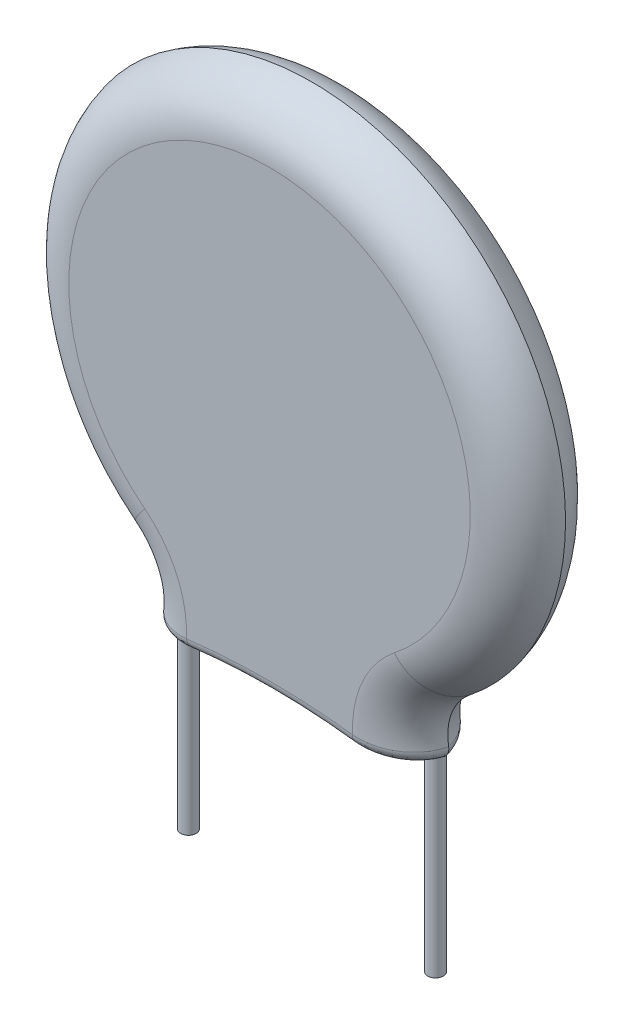
from build123d import *

# Parameters (mm, degrees)
BOSS_EXTRUDE1_DEPTH = 1.375
FILLET1_R           = 1.75
FILLET7_R           = 0.35
WRAP1_START         = -0.01
WRAP1_DEPTH         = 0.01


# Read off the part's stored shape, not the designer's step: Wrap1
with BuildPart() as part:
    # Sketch1 → Boss-Extrude1 (new, symmetric)
    with BuildSketch(Plane.XY):
        with BuildLine():
            ThreePointArc((4.65, -8.75), (4.475030194, -7.520172414), (5.127467489, -6.463093466))
            ThreePointArc((5.127467489, -6.463093466), (0, 8.25), (-5.127467489, -6.463093466))
            ThreePointArc((-5.127467489, -6.463093466), (-4.475030194, -7.520172414), (-4.65, -8.75))
            ThreePointArc((-4.65, -8.75), (0, -8.25), (4.65, -8.75))
        make_face()
    extrude(amount=BOSS_EXTRUDE1_DEPTH, both=True)

    # Fillet1
    # the kernel refuses this fillet: 1.75 mm, written as the material it takes off along each edge
    with BuildSketch(Plane(origin=(-6.262102122, -7.893282872, -1.375), x_dir=(0.6215112107703308, 0.7834052686105688, 0), z_dir=(-0.7834052686105688, 0.6215112107703308, 0))) as fillet1_piece_1:
        with BuildLine():
            CenterArc((1.825606061 + FILLET1_R, -FILLET1_R), FILLET1_R, 90, 90)
            Line((1.825606061 + FILLET1_R, 0), (1.825606061, 0))
            Line((1.825606061, 0), (1.825606061, -FILLET1_R))
        make_face()
    revolve(axis=Axis((-6.262102122, -7.893282872, -1.375), (0, 0, -1)), revolution_arc=216.911277343, mode=Mode.SUBTRACT)
    with BuildSketch(Plane(origin=(0, 0, -1.375), x_dir=(0.62151121077033, -0.7834052686105696, 0), z_dir=(-0.7834052686105696, -0.62151121077033, 0))) as fillet1_piece_2:
        with BuildLine():
            CenterArc((8.25 - FILLET1_R, FILLET1_R), FILLET1_R, 270, 90)
            Line((8.25 - FILLET1_R, 0), (8.25, 0))
            Line((8.25, 0), (8.25, FILLET1_R))
        make_face()
    revolve(axis=Axis((0, 0, -1.375), (0, 0, 1)), revolution_arc=283.146849467, mode=Mode.SUBTRACT)
    with BuildSketch(Plane(origin=(-6.262102122, -7.893282872, 1.375), x_dir=(0.6215112107703308, 0.7834052686105688, 0), z_dir=(-0.7834052686105688, 0.6215112107703308, 0))) as fillet1_piece_3:
        with BuildLine():
            CenterArc((1.825606061 + FILLET1_R, FILLET1_R), FILLET1_R, 180, 90)
            Line((1.825606061 + FILLET1_R, 0), (1.825606061, 0))
            Line((1.825606061, 0), (1.825606061, FILLET1_R))
        make_face()
    revolve(axis=Axis((-6.262102122, -7.893282872, 1.375), (0, 0, -1)), revolution_arc=216.911277343, mode=Mode.SUBTRACT)
    with BuildSketch(Plane(origin=(0, 0, 1.375), x_dir=(0.62151121077033, -0.7834052686105696, 0), z_dir=(-0.7834052686105696, -0.62151121077033, 0))) as fillet1_piece_4:
        with BuildLine():
            CenterArc((8.25 - FILLET1_R, -FILLET1_R), FILLET1_R, 0, 90)
            Line((8.25 - FILLET1_R, 0), (8.25, 0))
            Line((8.25, 0), (8.25, -FILLET1_R))
        make_face()
    revolve(axis=Axis((0, 0, 1.375), (0, 0, 1)), revolution_arc=283.146849467, mode=Mode.SUBTRACT)
    with BuildSketch(Plane(origin=(6.262102122, -7.893282872, -1.375), x_dir=(0.967435187537715, -0.25311886123690236, 0), z_dir=(0.25311886123690236, 0.967435187537715, 0))) as fillet1_piece_5:
        with BuildLine():
            CenterArc((1.825606061 + FILLET1_R, -FILLET1_R), FILLET1_R, 90, 90)
            Line((1.825606061 + FILLET1_R, 0), (1.825606061, 0))
            Line((1.825606061, 0), (1.825606061, -FILLET1_R))
        make_face()
    revolve(axis=Axis((6.262102122, -7.893282872, -1.375), (0, 0, -1)), revolution_arc=216.911277343, mode=Mode.SUBTRACT)
    with BuildSketch(Plane(origin=(6.262102122, -7.893282872, 1.375), x_dir=(0.967435187537715, -0.25311886123690236, 0), z_dir=(0.25311886123690236, 0.967435187537715, 0))) as fillet1_piece_6:
        with BuildLine():
            CenterArc((1.825606061 + FILLET1_R, FILLET1_R), FILLET1_R, 180, 90)
            Line((1.825606061 + FILLET1_R, 0), (1.825606061, 0))
            Line((1.825606061, 0), (1.825606061, FILLET1_R))
        make_face()
    revolve(axis=Axis((6.262102122, -7.893282872, 1.375), (0, 0, -1)), revolution_arc=216.911277343, mode=Mode.SUBTRACT)

    # Fillet7
    fillet7_edges = [part.edges().sort_by_distance(p)[0] for p in [
        (0, -8.25, -1.375),
        (0, -8.25, 1.375),
        (3.883166688, -8.597461727, 0.990381708),
        (3.883166674, -8.597461724, -0.99038172),
        (-3.883166688, -8.597461727, 0.990381708),
        (-3.883166674, -8.597461724, -0.99038172),
    ]]
    fillet(fillet7_edges, radius=FILLET7_R)

    # Wrap1 outline → Wrap1 (cut)
    # profile 1 of 7: a face of its own
    with BuildSketch(Plane(origin=(0, 0, -1.375), x_dir=(-1, 0, 0), z_dir=(0, 0, -1)).offset(WRAP1_START)):
        with BuildLine():
            Line((-3.1328125, 1.921875), (-3.30171131, 1.841145833))
            add(Edge.make_bspline(
                [(-3.30171131, 1.841145833), (-3.308983221, 1.836588799), (-3.325484554, 1.826248034), (-3.335289673, 1.809319532), (-3.34077381, 1.79985119)],
                knots=[0, 0, 0, 0, 0.440686357, 1, 1, 1, 1], degree=3))
            add(Edge.make_bspline(
                [(-3.34077381, 1.79985119), (-3.341785543, 1.795872347), (-3.344084095, 1.786832834), (-3.344823915, 1.777529689), (-3.345238095, 1.772321429)],
                knots=[0, 0, 0, 0, 0.440161289, 1, 1, 1, 1], degree=3))
            add(Edge.make_bspline(
                [(-3.345238095, 1.772321429), (-3.341645939, 1.75263571), (-3.33352536, 1.70813335), (-3.288739574, 1.696558728), (-3.263764881, 1.690104167)],
                knots=[0, 0, 0, 0, 0.442352233, 1, 1, 1, 1], degree=3))
            add(Edge.make_bspline(
                [(-3.263764881, 1.690104167), (-3.25875924, 1.690529932), (-3.247385305, 1.691497366), (-3.236182944, 1.693704626), (-3.229910714, 1.694940476)],
                knots=[0, 0, 0, 0, 0.440097523, 1, 1, 1, 1], degree=3))
            Line((-3.229910714, 1.694940476), (-3.017113095, 1.795758929))
            Line((-3.017113095, 1.795758929), (-2.892857143, 1.964657738))
            Line((-2.892857143, 1.964657738), (-2.892857143, 0.260044643))
            Line((-2.892857143, 0.260044643), (-2.885044643, 0.242931548))
            add(Edge.make_bspline(
                [(-2.885044643, 0.242931548), (-2.874777722, 0.230849901), (-2.851230468, 0.203140559), (-2.814335212, 0.202654873), (-2.793526786, 0.202380952)],
                knots=[0, 0, 0, 0, 0.4360135, 1, 1, 1, 1], degree=3))
            add(Edge.make_bspline(
                [(-2.793526786, 0.202380952), (-2.775613632, 0.204618051), (-2.735633937, 0.209610949), (-2.714446983, 0.244505211), (-2.702752976, 0.263764881)],
                knots=[0, 0, 0, 0, 0.448056269, 1, 1, 1, 1], degree=3))
            Line((-2.702752976, 0.263764881), (-2.702380952, 2.132440476))
            Line((-2.702380952, 2.132440476), (-2.712797619, 2.159598214))
            add(Edge.make_bspline(
                [(-2.712797619, 2.159598214), (-2.725109639, 2.170236987), (-2.753005603, 2.194341792), (-2.789744084, 2.199499579), (-2.810267857, 2.202380952)],
                knots=[0, 0, 0, 0, 0.441354866, 1, 1, 1, 1], degree=3))
            add(Edge.make_bspline(
                [(-2.810267857, 2.202380952), (-2.818421216, 2.202046007), (-2.836875667, 2.201287885), (-2.85203133, 2.1905292), (-2.860491071, 2.18452381)],
                knots=[0, 0, 0, 0, 0.441809915, 1, 1, 1, 1], degree=3))
            Line((-2.860491071, 2.18452381), (-3.1328125, 1.921875))
        make_face()
    # profile 2 of 7: a face of its own
    with BuildSketch(Plane(origin=(0, 0, -1.375), x_dir=(-1, 0, 0), z_dir=(0, 0, -1)).offset(WRAP1_START)):
        with BuildLine():
            Line((0.928571429, -0.395089286), (1.640997024, -2.248139881))
            add(Edge.make_bspline(
                [(1.640997024, -2.248139881), (1.647308346, -2.260858798), (1.66156507, -2.289589717), (1.693746528, -2.294745617), (1.711681548, -2.297619048)],
                knots=[0, 0, 0, 0, 0.44269091, 1, 1, 1, 1], degree=3))
            add(Edge.make_bspline(
                [(1.711681548, -2.297619048), (1.72906646, -2.296816711), (1.768297032, -2.295006168), (1.795972668, -2.26657566), (1.811383929, -2.250744048)],
                knots=[0, 0, 0, 0, 0.443147037, 1, 1, 1, 1], degree=3))
            Line((1.811383929, -2.250744048), (2.523809524, -0.389136905))
            add(Edge.make_bspline(
                [(2.523809524, -0.389136905), (2.52360421, -0.382404249), (2.523138145, -0.367121051), (2.519036072, -0.352373106), (2.516741071, -0.344122024)],
                knots=[0, 0, 0, 0, 0.44052667, 1, 1, 1, 1], degree=3))
            add(Edge.make_bspline(
                [(2.516741071, -0.344122024), (2.505579268, -0.332673805), (2.4801106, -0.306551605), (2.443774609, -0.300832), (2.423363095, -0.297619048)],
                knots=[0, 0, 0, 0, 0.438256296, 1, 1, 1, 1], degree=3))
            add(Edge.make_bspline(
                [(2.423363095, -0.297619048), (2.411382539, -0.300012814), (2.384263898, -0.305431236), (2.364709974, -0.32524766), (2.353794643, -0.336309524)],
                knots=[0, 0, 0, 0, 0.441783061, 1, 1, 1, 1], degree=3))
            Line((2.353794643, -0.336309524), (1.725074405, -2.045386905))
            Line((1.725074405, -2.045386905), (1.102678571, -0.345610119))
            add(Edge.make_bspline(
                [(1.102678571, -0.345610119), (1.091119569, -0.334433258), (1.064831844, -0.309014607), (1.028764617, -0.301711114), (1.008556548, -0.297619048)],
                knots=[0, 0, 0, 0, 0.43971102, 1, 1, 1, 1], degree=3))
            add(Edge.make_bspline(
                [(1.008556548, -0.297619048), (0.998432776, -0.299407741), (0.975385693, -0.303479756), (0.956593816, -0.317601996), (0.946056548, -0.325520833)],
                knots=[0, 0, 0, 0, 0.439264753, 1, 1, 1, 1], degree=3))
            add(Edge.make_bspline(
                [(0.946056548, -0.325520833), (0.940937244, -0.334997611), (0.929270063, -0.356595722), (0.928822571, -0.381251771), (0.928571429, -0.395089286)],
                knots=[0, 0, 0, 0, 0.438778094, 1, 1, 1, 1], degree=3))
        make_face()
    # profile 3 of 7: a face of its own
    with BuildSketch(Plane(origin=(0, 0, -1.375), x_dir=(-1, 0, 0), z_dir=(0, 0, -1)).offset(WRAP1_START)):
        with BuildLine():
            Line((-0.785714286, -1.449032738), (-0.785714286, -0.366815476))
            add(Edge.make_bspline(
                [(-0.785714286, -0.366815476), (-0.79519786, -0.348256433), (-0.81696731, -0.305654339), (-0.865478957, -0.300517877), (-0.892857143, -0.297619048)],
                knots=[0, 0, 0, 0, 0.435636873, 1, 1, 1, 1], degree=3))
            add(Edge.make_bspline(
                [(-0.892857143, -0.297619048), (-0.911346879, -0.298688184), (-0.95268093, -0.301078252), (-0.967822244, -0.340541064), (-0.976190476, -0.36235119)],
                knots=[0, 0, 0, 0, 0.447324562, 1, 1, 1, 1], degree=3))
            Line((-0.976190476, -0.36235119), (-0.976190476, -2.226190476))
            add(Edge.make_bspline(
                [(-0.976190476, -2.226190476), (-0.971803093, -2.24485099), (-0.961827502, -2.287279393), (-0.917621065, -2.293906577), (-0.892857143, -2.297619048)],
                knots=[0, 0, 0, 0, 0.439811847, 1, 1, 1, 1], degree=3))
            Line((-0.892857143, -2.297619048), (-0.858630952, -2.297619048))
            add(Edge.make_bspline(
                [(-0.858630952, -2.297619048), (-0.844546159, -2.291434274), (-0.812777933, -2.277484526), (-0.795391983, -2.247161639), (-0.785714286, -2.230282738)],
                knots=[0, 0, 0, 0, 0.443361007, 1, 1, 1, 1], degree=3))
            Line((-0.785714286, -2.230282738), (-0.785714286, -1.632440476))
            Line((-0.785714286, -1.632440476), (-0.450892857, -1.27827381))
            Line((-0.450892857, -1.27827381), (0.269717262, -2.261904762))
            add(Edge.make_bspline(
                [(0.269717262, -2.261904762), (0.27971902, -2.271965965), (0.302506095, -2.294888472), (0.335122363, -2.296637633), (0.353422619, -2.297619048)],
                knots=[0, 0, 0, 0, 0.438922434, 1, 1, 1, 1], degree=3))
            add(Edge.make_bspline(
                [(0.353422619, -2.297619048), (0.373175408, -2.293671513), (0.417098243, -2.284893668), (0.431698081, -2.241748217), (0.439732143, -2.218005952)],
                knots=[0, 0, 0, 0, 0.449715703, 1, 1, 1, 1], degree=3))
            add(Edge.make_bspline(
                [(0.439732143, -2.218005952), (0.438538582, -2.21290242), (0.435827168, -2.201308713), (0.430221432, -2.190786297), (0.427083333, -2.184895833)],
                knots=[0, 0, 0, 0, 0.440198566, 1, 1, 1, 1], degree=3))
            Line((0.427083333, -2.184895833), (-0.335193452, -1.171502976))
            Line((-0.335193452, -1.171502976), (0.366071429, -0.474702381))
            Line((0.366071429, -0.474702381), (0.42671131, -0.411830357))
            add(Edge.make_bspline(
                [(0.42671131, -0.411830357), (0.429907307, -0.407239301), (0.437135694, -0.396855711), (0.438802376, -0.384259178), (0.439732143, -0.377232143)],
                knots=[0, 0, 0, 0, 0.442145323, 1, 1, 1, 1], degree=3))
            add(Edge.make_bspline(
                [(0.439732143, -0.377232143), (0.438690898, -0.370352545), (0.436322271, -0.354702812), (0.428732491, -0.340769538), (0.424479167, -0.33296131)],
                knots=[0, 0, 0, 0, 0.439598435, 1, 1, 1, 1], degree=3))
            add(Edge.make_bspline(
                [(0.424479167, -0.33296131), (0.415672627, -0.324532905), (0.395634579, -0.305355252), (0.36810766, -0.300636163), (0.352678571, -0.297991071)],
                knots=[0, 0, 0, 0, 0.439490913, 1, 1, 1, 1], degree=3))
            add(Edge.make_bspline(
                [(0.352678571, -0.297991071), (0.342905489, -0.297906513), (0.320798852, -0.297715242), (0.300427769, -0.306488965), (0.2890625, -0.311383929)],
                knots=[0, 0, 0, 0, 0.442088143, 1, 1, 1, 1], degree=3))
            Line((0.2890625, -0.311383929), (-0.785714286, -1.449032738))
        make_face()
    # profile 4 of 7: a face of its own
    with BuildSketch(Plane(origin=(0, 0, -1.375), x_dir=(-1, 0, 0), z_dir=(0, 0, -1)).offset(WRAP1_START)):
        with BuildLine():
            Line((-1.613095238, 0.318824405), (-1.587425595, 0.297991071))
            add(Edge.make_bspline(
                [(-1.587425595, 0.297991071), (-1.555567914, 0.287082506), (-1.491852699, 0.265265425), (-1.396146264, 0.232920834), (-1.331949366, 0.212560855), (-1.29985119, 0.202380952)],
                knots=[0, 0, 0, 0, 0.33333625, 0.666670958, 1, 1, 1, 1], degree=3))
            Line((-1.29985119, 0.202380952), (-1.075520833, 0.202380952))
            add(Edge.make_bspline(
                [(-1.075520833, 0.202380952), (-1.042603067, 0.213915836), (-0.976767439, 0.236985636), (-0.877851585, 0.271183728), (-0.810969013, 0.29103982), (-0.777529762, 0.300967262)],
                knots=[0, 0, 0, 0, 0.33334622, 0.666693401, 1, 1, 1, 1], degree=3))
            Line((-0.777529762, 0.300967262), (-0.760416667, 0.313244048))
            Line((-0.760416667, 0.313244048), (-0.563988095, 0.594122024))
            Line((-0.563988095, 0.594122024), (-0.554315476, 0.610491071))
            Line((-0.554315476, 0.610491071), (-0.464285714, 1.060639881))
            Line((-0.464285714, 1.060639881), (-0.464285714, 1.329613095))
            Line((-0.464285714, 1.329613095), (-0.554315476, 1.780505952))
            Line((-0.554315476, 1.780505952), (-0.563988095, 1.804315476))
            Line((-0.563988095, 1.804315476), (-0.741443452, 2.069196429))
            Line((-0.741443452, 2.069196429), (-0.771949405, 2.099702381))
            add(Edge.make_bspline(
                [(-0.771949405, 2.099702381), (-0.805375673, 2.110533963), (-0.872227636, 2.13219694), (-0.972482027, 2.164773947), (-1.038942429, 2.187613144), (-1.072172619, 2.199032738)],
                knots=[0, 0, 0, 0, 0.333337224, 0.66666872, 1, 1, 1, 1], degree=3))
            Line((-1.072172619, 2.199032738), (-1.286458333, 2.202008929))
            add(Edge.make_bspline(
                [(-1.286458333, 2.202008929), (-1.319499716, 2.19120706), (-1.385582558, 2.169603297), (-1.484410211, 2.136261338), (-1.551103617, 2.116600821), (-1.584449405, 2.106770833)],
                knots=[0, 0, 0, 0, 0.333338922, 0.666678613, 1, 1, 1, 1], degree=3))
            Line((-1.584449405, 2.106770833), (-1.606770833, 2.088541667))
            Line((-1.606770833, 2.088541667), (-1.791666667, 1.820684524))
            Line((-1.791666667, 1.820684524), (-1.802455357, 1.798735119))
            Line((-1.802455357, 1.798735119), (-1.892857143, 1.350818452))
            Line((-1.892857143, 1.350818452), (-1.892857143, 1.063244048))
            Line((-1.892857143, 1.063244048), (-1.803199405, 0.613839286))
            Line((-1.803199405, 0.613839286), (-1.796502976, 0.594866071))
            Line((-1.796502976, 0.594866071), (-1.613095238, 0.318824405))
        make_face()
        Polygon((-0.738467262, 1.738467262), (-0.654761905, 1.319196429), (-0.654761905, 1.074032738), (-0.736235119, 0.667410714), (-0.888764881, 0.443824405), (-1.111235119, 0.369047619), (-1.265625, 0.369047619), (-1.466517857, 0.436011905), (-1.618303571, 0.66108631), (-1.702380952, 1.074404762), (-1.702380952, 1.340029762), (-1.620535714, 1.74702381), (-1.469866071, 1.968005952), (-1.264136905, 2.035714286), (-1.108630952, 2.035714286), (-0.891741071, 1.96577381), align=None, mode=Mode.SUBTRACT)
    # profile 5 of 7: a face of its own
    with BuildSketch(Plane(origin=(0, 0, -1.375), x_dir=(-1, 0, 0), z_dir=(0, 0, -1)).offset(WRAP1_START)):
        with BuildLine():
            Line((0.107142857, 1.314732143), (0.107142857, 1.514136905))
            add(Edge.make_bspline(
                [(0.107142857, 1.514136905), (0.10371724, 1.523140345), (0.095884924, 1.543725771), (0.079281862, 1.558359105), (0.069940476, 1.566592262)],
                knots=[0, 0, 0, 0, 0.43736965, 1, 1, 1, 1], degree=3))
            add(Edge.make_bspline(
                [(0.069940476, 1.566592262), (0.060361232, 1.57156837), (0.038543246, 1.582902109), (0.013851033, 1.583178367), (0, 1.583333333)],
                knots=[0, 0, 0, 0, 0.439052626, 1, 1, 1, 1], degree=3))
            add(Edge.make_bspline(
                [(0, 1.583333333), (-0.018489736, 1.582264197), (-0.059823788, 1.579874129), (-0.074965101, 1.540411317), (-0.083333333, 1.51860119)],
                knots=[0, 0, 0, 0, 0.447324562, 1, 1, 1, 1], degree=3))
            Line((-0.083333333, 1.51860119), (-0.083333333, 0.273809524))
            add(Edge.make_bspline(
                [(-0.083333333, 0.273809524), (-0.07894595, 0.25514901), (-0.068970359, 0.212720607), (-0.024763922, 0.206093423), (0, 0.202380952)],
                knots=[0, 0, 0, 0, 0.439811847, 1, 1, 1, 1], degree=3))
            Line((0, 0.202380952), (0.03422619, 0.202380952))
            add(Edge.make_bspline(
                [(0.03422619, 0.202380952), (0.048145895, 0.208524845), (0.079553997, 0.222387784), (0.097275383, 0.252072432), (0.107142857, 0.26860119)],
                knots=[0, 0, 0, 0, 0.443188324, 1, 1, 1, 1], degree=3))
            Line((0.107142857, 0.26860119), (0.107142857, 1.123511905))
            Line((0.107142857, 1.123511905), (0.334449405, 1.347842262))
            Line((0.334449405, 1.347842262), (0.473958333, 1.416666667))
            Line((0.473958333, 1.416666667), (0.696428571, 1.416666667))
            Line((0.696428571, 1.416666667), (0.825520833, 1.352306548))
            Line((0.825520833, 1.352306548), (0.901785714, 1.141369048))
            Line((0.901785714, 1.141369048), (0.904389881, 0.27046131))
            add(Edge.make_bspline(
                [(0.904389881, 0.27046131), (0.911876036, 0.249964434), (0.929064756, 0.202902217), (0.980588734, 0.202569028), (1.009672619, 0.202380952)],
                knots=[0, 0, 0, 0, 0.435527199, 1, 1, 1, 1], degree=3))
            add(Edge.make_bspline(
                [(1.009672619, 0.202380952), (1.024142616, 0.206592228), (1.056438538, 0.215991471), (1.073528438, 0.245335904), (1.08296131, 0.261532738)],
                knots=[0, 0, 0, 0, 0.448044066, 1, 1, 1, 1], degree=3))
            Line((1.08296131, 0.261532738), (1.083333333, 1.163318452))
            add(Edge.make_bspline(
                [(1.083333333, 1.163318452), (1.073081056, 1.191048087), (1.052576669, 1.246506902), (1.022980406, 1.330114523), (1.003195783, 1.385832013), (0.993303571, 1.413690476)],
                knots=[0, 0, 0, 0, 0.333339212, 0.666672978, 1, 1, 1, 1], degree=3))
            add(Edge.make_bspline(
                [(0.993303571, 1.413690476), (0.989426009, 1.427227358), (0.980619954, 1.457970007), (0.952496072, 1.473945747), (0.936755952, 1.482886905)],
                knots=[0, 0, 0, 0, 0.440329044, 1, 1, 1, 1], degree=3))
            Line((0.936755952, 1.482886905), (0.739955357, 1.579985119))
            Line((0.739955357, 1.579985119), (0.435267857, 1.58296131))
            Line((0.435267857, 1.58296131), (0.417782738, 1.578869048))
            Line((0.417782738, 1.578869048), (0.219866071, 1.483630952))
            Line((0.219866071, 1.483630952), (0.107142857, 1.314732143))
        make_face()
    # profile 6 of 7: a face of its own
    with BuildSketch(Plane(origin=(0, 0, -1.375), x_dir=(-1, 0, 0), z_dir=(0, 0, -1)).offset(WRAP1_START)):
        with BuildLine():
            Line((1.738095238, 0.202380952), (1.772321429, 0.202380952))
            add(Edge.make_bspline(
                [(1.772321429, 0.202380952), (1.786241133, 0.208524845), (1.817649235, 0.222387784), (1.835370621, 0.252072432), (1.845238095, 0.26860119)],
                knots=[0, 0, 0, 0, 0.443188324, 1, 1, 1, 1], degree=3))
            Line((1.845238095, 0.26860119), (1.845238095, 1.154761905))
            Line((1.845238095, 1.154761905), (2.451264881, 1.154761905))
            add(Edge.make_bspline(
                [(2.451264881, 1.154761905), (2.464338127, 1.15654097), (2.494063157, 1.160586082), (2.515751888, 1.181651603), (2.527901786, 1.193452381)],
                knots=[0, 0, 0, 0, 0.439805989, 1, 1, 1, 1], degree=3))
            add(Edge.make_bspline(
                [(2.527901786, 1.193452381), (2.531784088, 1.200153845), (2.540569965, 1.215319654), (2.54246765, 1.232802175), (2.543526786, 1.242559524)],
                knots=[0, 0, 0, 0, 0.441879805, 1, 1, 1, 1], degree=3))
            add(Edge.make_bspline(
                [(2.543526786, 1.242559524), (2.538909679, 1.259003585), (2.528333865, 1.29666989), (2.491888499, 1.312506043), (2.471354167, 1.321428571)],
                knots=[0, 0, 0, 0, 0.436572178, 1, 1, 1, 1], degree=3))
            Line((2.471354167, 1.321428571), (1.845238095, 1.321428571))
            Line((1.845238095, 1.321428571), (1.845238095, 2.035714286))
            Line((1.845238095, 2.035714286), (2.873883929, 2.035714286))
            add(Edge.make_bspline(
                [(2.873883929, 2.035714286), (2.884555337, 2.035645542), (2.908606289, 2.035490608), (2.930040459, 2.046630346), (2.941964286, 2.052827381)],
                knots=[0, 0, 0, 0, 0.443700072, 1, 1, 1, 1], degree=3))
            add(Edge.make_bspline(
                [(2.941964286, 2.052827381), (2.952580451, 2.062238387), (2.976648448, 2.083574157), (2.980172969, 2.115875208), (2.982142857, 2.133928571)],
                knots=[0, 0, 0, 0, 0.441090537, 1, 1, 1, 1], degree=3))
            add(Edge.make_bspline(
                [(2.982142857, 2.133928571), (2.976061937, 2.14847796), (2.962104771, 2.181872289), (2.927112663, 2.193080049), (2.907366071, 2.199404762)],
                knots=[0, 0, 0, 0, 0.435684404, 1, 1, 1, 1], degree=3))
            Line((2.907366071, 2.199404762), (1.721354167, 2.202380952))
            add(Edge.make_bspline(
                [(1.721354167, 2.202380952), (1.708189732, 2.198115428), (1.6784777, 2.188488173), (1.663245315, 2.160852509), (1.654761905, 2.14546131)],
                knots=[0, 0, 0, 0, 0.443067479, 1, 1, 1, 1], degree=3))
            Line((1.654761905, 2.14546131), (1.654761905, 0.273809524))
            add(Edge.make_bspline(
                [(1.654761905, 0.273809524), (1.659149288, 0.25514901), (1.669124879, 0.212720607), (1.713331316, 0.206093423), (1.738095238, 0.202380952)],
                knots=[0, 0, 0, 0, 0.439811847, 1, 1, 1, 1], degree=3))
        make_face()
    # profile 7 of 7: a face of its own
    with BuildSketch(Plane(origin=(0, 0, -1.375), x_dir=(-1, 0, 0), z_dir=(0, 0, -1)).offset(WRAP1_START)):
        with BuildLine():
            add(Edge.make_bspline(
                [(-2.436383929, -0.373511905), (-2.450984468, -0.380075262), (-2.484211886, -0.395011931), (-2.51030059, -0.420568908), (-2.524925595, -0.434895833)],
                knots=[0, 0, 0, 0, 0.439412387, 1, 1, 1, 1], degree=3))
            add(Edge.make_bspline(
                [(-2.524925595, -0.434895833), (-2.535772784, -0.445717274), (-2.560425115, -0.47031109), (-2.584172089, -0.495781424), (-2.597470238, -0.510044643)],
                knots=[0, 0, 0, 0, 0.440006596, 1, 1, 1, 1], degree=3))
            add(Edge.make_bspline(
                [(-2.597470238, -0.510044643), (-2.612340988, -0.539549008), (-2.646138089, -0.60660427), (-2.679329501, -0.673961531), (-2.697916667, -0.711681548)],
                knots=[0, 0, 0, 0, 0.440000746, 1, 1, 1, 1], degree=3))
            add(Edge.make_bspline(
                [(-2.697916667, -0.711681548), (-2.698074902, -0.719985221), (-2.698434518, -0.738856785), (-2.699771908, -0.757685353), (-2.700520833, -0.768229167)],
                knots=[0, 0, 0, 0, 0.44000979, 1, 1, 1, 1], degree=3))
            add(Edge.make_bspline(
                [(-2.700520833, -0.768229167), (-2.698565473, -0.771409619), (-2.694366004, -0.778240179), (-2.698377287, -0.785293404), (-2.700520833, -0.7890625)],
                knots=[0, 0, 0, 0, 0.465620921, 1, 1, 1, 1], degree=3))
            add(Edge.make_bspline(
                [(-2.700520833, -0.7890625), (-2.700289291, -0.804297833), (-2.699768115, -0.838590927), (-2.678491022, -0.865820206), (-2.666666667, -0.880952381)],
                knots=[0, 0, 0, 0, 0.444268247, 1, 1, 1, 1], degree=3))
            add(Edge.make_bspline(
                [(-2.666666667, -0.880952381), (-2.660057231, -0.88576297), (-2.644988912, -0.896730246), (-2.626230046, -0.897347145), (-2.615699405, -0.897693452)],
                knots=[0, 0, 0, 0, 0.438631212, 1, 1, 1, 1], degree=3))
            add(Edge.make_bspline(
                [(-2.615699405, -0.897693452), (-2.609389708, -0.897219283), (-2.595048852, -0.896141578), (-2.581100205, -0.892605355), (-2.57328869, -0.890625)],
                knots=[0, 0, 0, 0, 0.43998046, 1, 1, 1, 1], degree=3))
            add(Edge.make_bspline(
                [(-2.57328869, -0.890625), (-2.559226654, -0.882663353), (-2.527542564, -0.864724447), (-2.519406222, -0.828774435), (-2.514880952, -0.808779762)],
                knots=[0, 0, 0, 0, 0.443820123, 1, 1, 1, 1], degree=3))
            Line((-2.514880952, -0.808779762), (-2.514880952, -0.745907738))
            Line((-2.514880952, -0.745907738), (-2.440104167, -0.59672619))
            Line((-2.440104167, -0.59672619), (-2.377232143, -0.532738095))
            Line((-2.377232143, -0.532738095), (-2.240327381, -0.464285714))
            Line((-2.240327381, -0.464285714), (-1.935639881, -0.464285714))
            Line((-1.935639881, -0.464285714), (-1.78422619, -0.536830357))
            Line((-1.78422619, -0.536830357), (-1.718005952, -0.605282738))
            Line((-1.718005952, -0.605282738), (-1.642857143, -0.752604167))
            Line((-1.642857143, -0.752604167), (-1.642857143, -0.890997024))
            Line((-1.642857143, -0.890997024), (-1.71391369, -1.031994048))
            Line((-1.71391369, -1.031994048), (-1.884672619, -1.290550595))
            Line((-1.884672619, -1.290550595), (-2.755208333, -2.154017857))
            add(Edge.make_bspline(
                [(-2.755208333, -2.154017857), (-2.763092206, -2.16338521), (-2.780993745, -2.184655217), (-2.784020513, -2.212479937), (-2.785714286, -2.228050595)],
                knots=[0, 0, 0, 0, 0.440401981, 1, 1, 1, 1], degree=3))
            add(Edge.make_bspline(
                [(-2.785714286, -2.228050595), (-2.782857469, -2.242490297), (-2.77642174, -2.275019518), (-2.746054119, -2.289542698), (-2.729166667, -2.297619048)],
                knots=[0, 0, 0, 0, 0.443899416, 1, 1, 1, 1], degree=3))
            Line((-2.729166667, -2.297619048), (-1.465401786, -2.297619048))
            add(Edge.make_bspline(
                [(-1.465401786, -2.297619048), (-1.451559774, -2.296652241), (-1.420194557, -2.294461511), (-1.39740484, -2.272380771), (-1.384672619, -2.260044643)],
                knots=[0, 0, 0, 0, 0.441317253, 1, 1, 1, 1], degree=3))
            add(Edge.make_bspline(
                [(-1.384672619, -2.260044643), (-1.382212005, -2.253785945), (-1.376621693, -2.239566703), (-1.372720032, -2.224790316), (-1.370535714, -2.216517857)],
                knots=[0, 0, 0, 0, 0.440156891, 1, 1, 1, 1], degree=3))
            add(Edge.make_bspline(
                [(-1.370535714, -2.216517857), (-1.375121414, -2.197698768), (-1.38563463, -2.154553966), (-1.428316338, -2.139461659), (-1.452380952, -2.130952381)],
                knots=[0, 0, 0, 0, 0.436184375, 1, 1, 1, 1], degree=3))
            Line((-1.452380952, -2.130952381), (-2.522693452, -2.130952381))
            Line((-2.522693452, -2.130952381), (-1.742559524, -1.387276786))
            Line((-1.742559524, -1.387276786), (-1.550223214, -1.109747024))
            add(Edge.make_bspline(
                [(-1.550223214, -1.109747024), (-1.535815704, -1.081239215), (-1.5030713, -1.016448621), (-1.470577505, -0.951531957), (-1.452380952, -0.915178571)],
                knots=[0, 0, 0, 0, 0.439999186, 1, 1, 1, 1], degree=3))
            Line((-1.452380952, -0.915178571), (-1.452380952, -0.715401786))
            add(Edge.make_bspline(
                [(-1.452380952, -0.715401786), (-1.463087719, -0.693200298), (-1.487420625, -0.642743728), (-1.513131805, -0.592974401), (-1.527529762, -0.565104167)],
                knots=[0, 0, 0, 0, 0.440011819, 1, 1, 1, 1], degree=3))
            add(Edge.make_bspline(
                [(-1.527529762, -0.565104167), (-1.543528597, -0.538051202), (-1.580060725, -0.476277804), (-1.634313286, -0.4290658), (-1.664806548, -0.402529762)],
                knots=[0, 0, 0, 0, 0.437938763, 1, 1, 1, 1], degree=3))
            add(Edge.make_bspline(
                [(-1.664806548, -0.402529762), (-1.696643526, -0.387810818), (-1.768999448, -0.354359065), (-1.840764386, -0.319656482), (-1.880952381, -0.300223214)],
                knots=[0, 0, 0, 0, 0.440005163, 1, 1, 1, 1], degree=3))
            Line((-1.880952381, -0.300223214), (-2.26860119, -0.297619048))
            Line((-2.26860119, -0.297619048), (-2.287946429, -0.302083333))
            Line((-2.287946429, -0.302083333), (-2.436383929, -0.373511905))
        make_face()
    extrude(amount=WRAP1_DEPTH, mode=Mode.SUBTRACT)


with BuildPart() as body_2:
    # Sketch2 → Revolve1 (revolve)
    with BuildSketch(Plane.XY, mode=Mode.PRIVATE) as revolve1_sk:
        with BuildLine():
            Line((-4, -7.988835359), (-4, -14.738835359))
            Line((-4, -14.738835359), (-3.75, -14.738835359))
            Line((-3.75, -14.738835359), (-3.75, -8.228835359))
            ThreePointArc((-3.75, -8.228835359), (-3.820294373, -8.059129732), (-3.99, -7.988835359))
            Line((-3.99, -7.988835359), (-4, -7.988835359))
        make_face()
    revolve(revolve1_sk.sketch.rotate(Axis((-4, -7.988835359, 0), (0, -1, 0)), 180), axis=Axis((-4, -7.988835359, 0), (0, -1, 0)))


with BuildPart() as body_3:
    # Mirror2: mirrored copy
    add(body_2.part.mirror(Plane(origin=(0, 0, 0), x_dir=(0, 0, 1), z_dir=(1, 0, 0))))


solid = Compound([part.part, body_2.part, body_3.part])
